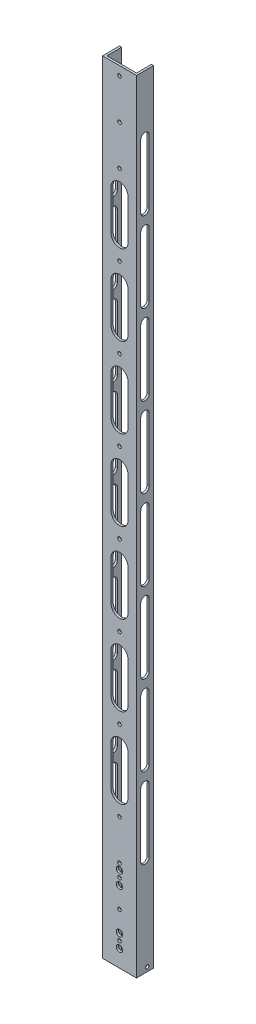
from build123d import *

# Parameters (mm, degrees)
BOSS_EXTRUDE1_DEPTH = 1168.4
IGUS_HOLES_REACH    = 1171.78
SKETCH2_R           = 2.667
CUT_EXTRUDE2_REACH  = 1171.715
SKETCH3_R           = 4.7625
SKETCH3_R_2         = 2.667
SKETCH4_R           = 2.667
CUT_EXTRUDE3_DEPTH  = 1170.77962027
BACK_CUTS_REACH     = 1171.78
CUT_EXTRUDE5_DEPTH  = 1170.77962027


with BuildPart() as part:
    # Sketch1 → Boss-Extrude1 (new body)
    with BuildSketch(Plane(origin=(0, 0, 0), x_dir=(1, 0, 0), z_dir=(0, 1, 0))):
        Polygon((3.175, 3.175), (3.175, 25.4), (0, 25.4), (0, 0), (50.8, 0), (50.8, 25.4), (47.625, 25.4), (47.625, 3.175), align=None)
    extrude(amount=BOSS_EXTRUDE1_DEPTH)

    # Sketch2 → Igus_Holes (cut, up to next)
    with BuildSketch(Plane.XY, mode=Mode.PRIVATE) as igus_holes_sk1:
        with Locations((25.4, 76.2)):
            Circle(SKETCH2_R)
    igus_holes_tool1 = extrude(igus_holes_sk1.sketch, amount=-IGUS_HOLES_REACH, mode=Mode.PRIVATE) & part.part
    # Sketch2 → Igus_Holes (cut, up to next)
    with BuildSketch(Plane.XY, mode=Mode.PRIVATE) as igus_holes_sk2:
        with Locations((25.4, 136.144)):
            Circle(SKETCH2_R)
    igus_holes_tool2 = extrude(igus_holes_sk2.sketch, amount=-IGUS_HOLES_REACH, mode=Mode.PRIVATE) & part.part
    # Sketch2 → Igus_Holes (cut, up to next)
    with BuildSketch(Plane.XY, mode=Mode.PRIVATE) as igus_holes_sk3:
        with Locations((25.4, 196.088)):
            Circle(SKETCH2_R)
    igus_holes_tool3 = extrude(igus_holes_sk3.sketch, amount=-IGUS_HOLES_REACH, mode=Mode.PRIVATE) & part.part
    # Sketch2 → Igus_Holes (cut, up to next)
    with BuildSketch(Plane.XY, mode=Mode.PRIVATE) as igus_holes_sk4:
        with Locations((25.4, 256.032)):
            Circle(SKETCH2_R)
    igus_holes_tool4 = extrude(igus_holes_sk4.sketch, amount=-IGUS_HOLES_REACH, mode=Mode.PRIVATE) & part.part
    # Sketch2 → Igus_Holes (cut, up to next)
    with BuildSketch(Plane.XY, mode=Mode.PRIVATE) as igus_holes_sk5:
        with Locations((25.4, 315.976)):
            Circle(SKETCH2_R)
    igus_holes_tool5 = extrude(igus_holes_sk5.sketch, amount=-IGUS_HOLES_REACH, mode=Mode.PRIVATE) & part.part
    # Sketch2 → Igus_Holes (cut, up to next)
    with BuildSketch(Plane.XY, mode=Mode.PRIVATE) as igus_holes_sk6:
        with Locations((25.4, 375.92)):
            Circle(SKETCH2_R)
    igus_holes_tool6 = extrude(igus_holes_sk6.sketch, amount=-IGUS_HOLES_REACH, mode=Mode.PRIVATE) & part.part
    # Sketch2 → Igus_Holes (cut, up to next)
    with BuildSketch(Plane.XY, mode=Mode.PRIVATE) as igus_holes_sk7:
        with Locations((25.4, 435.864)):
            Circle(SKETCH2_R)
    igus_holes_tool7 = extrude(igus_holes_sk7.sketch, amount=-IGUS_HOLES_REACH, mode=Mode.PRIVATE) & part.part
    # Sketch2 → Igus_Holes (cut, up to next)
    with BuildSketch(Plane.XY, mode=Mode.PRIVATE) as igus_holes_sk8:
        with Locations((25.4, 495.808)):
            Circle(SKETCH2_R)
    igus_holes_tool8 = extrude(igus_holes_sk8.sketch, amount=-IGUS_HOLES_REACH, mode=Mode.PRIVATE) & part.part
    # Sketch2 → Igus_Holes (cut, up to next)
    with BuildSketch(Plane.XY, mode=Mode.PRIVATE) as igus_holes_sk9:
        with Locations((25.4, 555.752)):
            Circle(SKETCH2_R)
    igus_holes_tool9 = extrude(igus_holes_sk9.sketch, amount=-IGUS_HOLES_REACH, mode=Mode.PRIVATE) & part.part
    # Sketch2 → Igus_Holes (cut, up to next)
    with BuildSketch(Plane.XY, mode=Mode.PRIVATE) as igus_holes_sk10:
        with Locations((25.4, 615.696)):
            Circle(SKETCH2_R)
    igus_holes_tool10 = extrude(igus_holes_sk10.sketch, amount=-IGUS_HOLES_REACH, mode=Mode.PRIVATE) & part.part
    # Sketch2 → Igus_Holes (cut, up to next)
    with BuildSketch(Plane.XY, mode=Mode.PRIVATE) as igus_holes_sk11:
        with Locations((25.4, 675.64)):
            Circle(SKETCH2_R)
    igus_holes_tool11 = extrude(igus_holes_sk11.sketch, amount=-IGUS_HOLES_REACH, mode=Mode.PRIVATE) & part.part
    # Sketch2 → Igus_Holes (cut, up to next)
    with BuildSketch(Plane.XY, mode=Mode.PRIVATE) as igus_holes_sk12:
        with Locations((25.4, 735.584)):
            Circle(SKETCH2_R)
    igus_holes_tool12 = extrude(igus_holes_sk12.sketch, amount=-IGUS_HOLES_REACH, mode=Mode.PRIVATE) & part.part
    # Sketch2 → Igus_Holes (cut, up to next)
    with BuildSketch(Plane.XY, mode=Mode.PRIVATE) as igus_holes_sk13:
        with Locations((25.4, 795.528)):
            Circle(SKETCH2_R)
    igus_holes_tool13 = extrude(igus_holes_sk13.sketch, amount=-IGUS_HOLES_REACH, mode=Mode.PRIVATE) & part.part
    # Sketch2 → Igus_Holes (cut, up to next)
    with BuildSketch(Plane.XY, mode=Mode.PRIVATE) as igus_holes_sk14:
        with Locations((25.4, 855.472)):
            Circle(SKETCH2_R)
    igus_holes_tool14 = extrude(igus_holes_sk14.sketch, amount=-IGUS_HOLES_REACH, mode=Mode.PRIVATE) & part.part
    # Sketch2 → Igus_Holes (cut, up to next)
    with BuildSketch(Plane.XY, mode=Mode.PRIVATE) as igus_holes_sk15:
        with Locations((25.4, 915.416)):
            Circle(SKETCH2_R)
    igus_holes_tool15 = extrude(igus_holes_sk15.sketch, amount=-IGUS_HOLES_REACH, mode=Mode.PRIVATE) & part.part
    # Sketch2 → Igus_Holes (cut, up to next)
    with BuildSketch(Plane.XY, mode=Mode.PRIVATE) as igus_holes_sk16:
        with Locations((25.4, 975.36)):
            Circle(SKETCH2_R)
    igus_holes_tool16 = extrude(igus_holes_sk16.sketch, amount=-IGUS_HOLES_REACH, mode=Mode.PRIVATE) & part.part
    # Sketch2 → Igus_Holes (cut, up to next)
    with BuildSketch(Plane.XY, mode=Mode.PRIVATE) as igus_holes_sk17:
        with Locations((25.4, 1035.304)):
            Circle(SKETCH2_R)
    igus_holes_tool17 = extrude(igus_holes_sk17.sketch, amount=-IGUS_HOLES_REACH, mode=Mode.PRIVATE) & part.part
    # Sketch2 → Igus_Holes (cut, up to next)
    with BuildSketch(Plane.XY, mode=Mode.PRIVATE) as igus_holes_sk18:
        with Locations((25.4, 1095.248)):
            Circle(SKETCH2_R)
    igus_holes_tool18 = extrude(igus_holes_sk18.sketch, amount=-IGUS_HOLES_REACH, mode=Mode.PRIVATE) & part.part
    # Sketch2 → Igus_Holes (cut, up to next)
    with BuildSketch(Plane.XY, mode=Mode.PRIVATE) as igus_holes_sk19:
        with Locations((25.4, 1155.192)):
            Circle(SKETCH2_R)
    igus_holes_tool19 = extrude(igus_holes_sk19.sketch, amount=-IGUS_HOLES_REACH, mode=Mode.PRIVATE) & part.part
    add(igus_holes_tool1.solids().sort_by_distance((25.4, 76.2, 0))[0], mode=Mode.SUBTRACT)
    add(igus_holes_tool2.solids().sort_by_distance((25.4, 136.144, 0))[0], mode=Mode.SUBTRACT)
    add(igus_holes_tool3.solids().sort_by_distance((25.4, 196.088, 0))[0], mode=Mode.SUBTRACT)
    add(igus_holes_tool4.solids().sort_by_distance((25.4, 256.032, 0))[0], mode=Mode.SUBTRACT)
    add(igus_holes_tool5.solids().sort_by_distance((25.4, 315.976, 0))[0], mode=Mode.SUBTRACT)
    add(igus_holes_tool6.solids().sort_by_distance((25.4, 375.92, 0))[0], mode=Mode.SUBTRACT)
    add(igus_holes_tool7.solids().sort_by_distance((25.4, 435.864, 0))[0], mode=Mode.SUBTRACT)
    add(igus_holes_tool8.solids().sort_by_distance((25.4, 495.808, 0))[0], mode=Mode.SUBTRACT)
    add(igus_holes_tool9.solids().sort_by_distance((25.4, 555.752, 0))[0], mode=Mode.SUBTRACT)
    add(igus_holes_tool10.solids().sort_by_distance((25.4, 615.696, 0))[0], mode=Mode.SUBTRACT)
    add(igus_holes_tool11.solids().sort_by_distance((25.4, 675.64, 0))[0], mode=Mode.SUBTRACT)
    add(igus_holes_tool12.solids().sort_by_distance((25.4, 735.584, 0))[0], mode=Mode.SUBTRACT)
    add(igus_holes_tool13.solids().sort_by_distance((25.4, 795.528, 0))[0], mode=Mode.SUBTRACT)
    add(igus_holes_tool14.solids().sort_by_distance((25.4, 855.472, 0))[0], mode=Mode.SUBTRACT)
    add(igus_holes_tool15.solids().sort_by_distance((25.4, 915.416, 0))[0], mode=Mode.SUBTRACT)
    add(igus_holes_tool16.solids().sort_by_distance((25.4, 975.36, 0))[0], mode=Mode.SUBTRACT)
    add(igus_holes_tool17.solids().sort_by_distance((25.4, 1035.304, 0))[0], mode=Mode.SUBTRACT)
    add(igus_holes_tool18.solids().sort_by_distance((25.4, 1095.248, 0))[0], mode=Mode.SUBTRACT)
    add(igus_holes_tool19.solids().sort_by_distance((25.4, 1155.192, 0))[0], mode=Mode.SUBTRACT)

    # Sketch3 → Cut-Extrude2 (cut, up to next)
    with BuildSketch(Plane(origin=(0, 0, -3.175), x_dir=(-1, 0, 0), z_dir=(0, 0, -1)), mode=Mode.PRIVATE) as cut_extrude2_sk1:
        with Locations((-25.4, 25.4)):
            Circle(SKETCH3_R)
    cut_extrude2_tool1 = extrude(cut_extrude2_sk1.sketch, amount=-CUT_EXTRUDE2_REACH, mode=Mode.PRIVATE) & part.part
    # Sketch3 → Cut-Extrude2 (cut, up to next)
    with BuildSketch(Plane(origin=(0, 0, -3.175), x_dir=(-1, 0, 0), z_dir=(0, 0, -1)), mode=Mode.PRIVATE) as cut_extrude2_sk2:
        with Locations((-25.4, 35.39998)):
            Circle(SKETCH3_R_2)
    cut_extrude2_tool2 = extrude(cut_extrude2_sk2.sketch, amount=-CUT_EXTRUDE2_REACH, mode=Mode.PRIVATE) & part.part
    # Sketch3 → Cut-Extrude2 (cut, up to next)
    with BuildSketch(Plane(origin=(0, 0, -3.175), x_dir=(-1, 0, 0), z_dir=(0, 0, -1)), mode=Mode.PRIVATE) as cut_extrude2_sk3:
        with Locations((-25.4, 117.00002)):
            Circle(SKETCH3_R_2)
    cut_extrude2_tool3 = extrude(cut_extrude2_sk3.sketch, amount=-CUT_EXTRUDE2_REACH, mode=Mode.PRIVATE) & part.part
    # Sketch3 → Cut-Extrude2 (cut, up to next)
    with BuildSketch(Plane(origin=(0, 0, -3.175), x_dir=(-1, 0, 0), z_dir=(0, 0, -1)), mode=Mode.PRIVATE) as cut_extrude2_sk4:
        with Locations((-25.4, 45.39996)):
            Circle(SKETCH3_R)
    cut_extrude2_tool4 = extrude(cut_extrude2_sk4.sketch, amount=-CUT_EXTRUDE2_REACH, mode=Mode.PRIVATE) & part.part
    # Sketch3 → Cut-Extrude2 (cut, up to next)
    with BuildSketch(Plane(origin=(0, 0, -3.175), x_dir=(-1, 0, 0), z_dir=(0, 0, -1)), mode=Mode.PRIVATE) as cut_extrude2_sk5:
        with Locations((-25.4, 107.00004)):
            Circle(SKETCH3_R)
    cut_extrude2_tool5 = extrude(cut_extrude2_sk5.sketch, amount=-CUT_EXTRUDE2_REACH, mode=Mode.PRIVATE) & part.part
    # Sketch3 → Cut-Extrude2 (cut, up to next)
    with BuildSketch(Plane(origin=(0, 0, -3.175), x_dir=(-1, 0, 0), z_dir=(0, 0, -1)), mode=Mode.PRIVATE) as cut_extrude2_sk6:
        with Locations((-25.4, 127)):
            Circle(SKETCH3_R)
    cut_extrude2_tool6 = extrude(cut_extrude2_sk6.sketch, amount=-CUT_EXTRUDE2_REACH, mode=Mode.PRIVATE) & part.part
    add(cut_extrude2_tool1.solids().sort_by_distance((25.4, 25.4, -3.175))[0], mode=Mode.SUBTRACT)
    add(cut_extrude2_tool2.solids().sort_by_distance((25.4, 35.39998, -3.175))[0], mode=Mode.SUBTRACT)
    add(cut_extrude2_tool3.solids().sort_by_distance((25.4, 117.00002, -3.175))[0], mode=Mode.SUBTRACT)
    add(cut_extrude2_tool4.solids().sort_by_distance((25.4, 45.39996, -3.175))[0], mode=Mode.SUBTRACT)
    add(cut_extrude2_tool5.solids().sort_by_distance((25.4, 107.00004, -3.175))[0], mode=Mode.SUBTRACT)
    add(cut_extrude2_tool6.solids().sort_by_distance((25.4, 127, -3.175))[0], mode=Mode.SUBTRACT)

    # Sketch4 → Cut-Extrude3 (cut, through all)
    with BuildSketch(Plane.ZY):
        with Locations((-15.875, 6.35)):
            Circle(SKETCH4_R)
    extrude(amount=-CUT_EXTRUDE3_DEPTH, mode=Mode.SUBTRACT)

    # Sketch5 → Back_Cuts (cut, up to next)
    with BuildSketch(Plane.XY, mode=Mode.PRIVATE) as back_cuts_sk1:
        with BuildLine():
            Line((38.1, 1005.36), (38.1, 945.36))
            ThreePointArc((38.1, 945.36), (25.4, 932.66), (12.7, 945.36))
            Line((12.7, 945.36), (12.7, 1005.36))
            ThreePointArc((12.7, 1005.36), (25.4, 1018.06), (38.1, 1005.36))
        make_face()
    back_cuts_tool1 = extrude(back_cuts_sk1.sketch, amount=-BACK_CUTS_REACH, mode=Mode.PRIVATE) & part.part
    # Sketch5 → Back_Cuts (cut, up to next)
    with BuildSketch(Plane.XY, mode=Mode.PRIVATE) as back_cuts_sk2:
        with BuildLine():
            Line((38.1, 885.472), (38.1, 825.472))
            ThreePointArc((38.1, 825.472), (25.4, 812.772), (12.7, 825.472))
            Line((12.7, 825.472), (12.7, 885.472))
            ThreePointArc((12.7, 885.472), (25.4, 898.172), (38.1, 885.472))
        make_face()
    back_cuts_tool2 = extrude(back_cuts_sk2.sketch, amount=-BACK_CUTS_REACH, mode=Mode.PRIVATE) & part.part
    # Sketch5 → Back_Cuts (cut, up to next)
    with BuildSketch(Plane.XY, mode=Mode.PRIVATE) as back_cuts_sk3:
        with BuildLine():
            Line((38.1, 765.584), (38.1, 705.584))
            ThreePointArc((38.1, 705.584), (25.4, 692.884), (12.7, 705.584))
            Line((12.7, 705.584), (12.7, 765.584))
            ThreePointArc((12.7, 765.584), (25.4, 778.284), (38.1, 765.584))
        make_face()
    back_cuts_tool3 = extrude(back_cuts_sk3.sketch, amount=-BACK_CUTS_REACH, mode=Mode.PRIVATE) & part.part
    # Sketch5 → Back_Cuts (cut, up to next)
    with BuildSketch(Plane.XY, mode=Mode.PRIVATE) as back_cuts_sk4:
        with BuildLine():
            Line((38.1, 645.696), (38.1, 585.696))
            ThreePointArc((38.1, 585.696), (25.4, 572.996), (12.7, 585.696))
            Line((12.7, 585.696), (12.7, 645.696))
            ThreePointArc((12.7, 645.696), (25.4, 658.396), (38.1, 645.696))
        make_face()
    back_cuts_tool4 = extrude(back_cuts_sk4.sketch, amount=-BACK_CUTS_REACH, mode=Mode.PRIVATE) & part.part
    # Sketch5 → Back_Cuts (cut, up to next)
    with BuildSketch(Plane.XY, mode=Mode.PRIVATE) as back_cuts_sk5:
        with BuildLine():
            Line((38.1, 525.808), (38.1, 465.808))
            ThreePointArc((38.1, 465.808), (25.4, 453.108), (12.7, 465.808))
            Line((12.7, 465.808), (12.7, 525.808))
            ThreePointArc((12.7, 525.808), (25.4, 538.508), (38.1, 525.808))
        make_face()
    back_cuts_tool5 = extrude(back_cuts_sk5.sketch, amount=-BACK_CUTS_REACH, mode=Mode.PRIVATE) & part.part
    # Sketch5 → Back_Cuts (cut, up to next)
    with BuildSketch(Plane.XY, mode=Mode.PRIVATE) as back_cuts_sk6:
        with BuildLine():
            Line((38.1, 405.92), (38.1, 345.92))
            ThreePointArc((38.1, 345.92), (25.4, 333.22), (12.7, 345.92))
            Line((12.7, 345.92), (12.7, 405.92))
            ThreePointArc((12.7, 405.92), (25.4, 418.62), (38.1, 405.92))
        make_face()
    back_cuts_tool6 = extrude(back_cuts_sk6.sketch, amount=-BACK_CUTS_REACH, mode=Mode.PRIVATE) & part.part
    # Sketch5 → Back_Cuts (cut, up to next)
    with BuildSketch(Plane.XY, mode=Mode.PRIVATE) as back_cuts_sk7:
        with BuildLine():
            Line((38.1, 286.032), (38.1, 226.032))
            ThreePointArc((38.1, 226.032), (25.4, 213.332), (12.7, 226.032))
            Line((12.7, 226.032), (12.7, 286.032))
            ThreePointArc((12.7, 286.032), (25.4, 298.732), (38.1, 286.032))
        make_face()
    back_cuts_tool7 = extrude(back_cuts_sk7.sketch, amount=-BACK_CUTS_REACH, mode=Mode.PRIVATE) & part.part
    add(back_cuts_tool1.solids().sort_by_distance((25.4, 975.36, 0))[0], mode=Mode.SUBTRACT)
    add(back_cuts_tool2.solids().sort_by_distance((25.4, 855.472, 0))[0], mode=Mode.SUBTRACT)
    add(back_cuts_tool3.solids().sort_by_distance((25.4, 735.584, 0))[0], mode=Mode.SUBTRACT)
    add(back_cuts_tool4.solids().sort_by_distance((25.4, 615.696, 0))[0], mode=Mode.SUBTRACT)
    add(back_cuts_tool5.solids().sort_by_distance((25.4, 495.808, 0))[0], mode=Mode.SUBTRACT)
    add(back_cuts_tool6.solids().sort_by_distance((25.4, 375.92, 0))[0], mode=Mode.SUBTRACT)
    add(back_cuts_tool7.solids().sort_by_distance((25.4, 256.032, 0))[0], mode=Mode.SUBTRACT)

    # Sketch6 → Cut-Extrude5 (cut, through all)
    with BuildSketch(Plane.ZY):
        with BuildLine():
            Line((-6.35, 1082.05), (-6.35, 987.25))
            ThreePointArc((-6.35, 987.25), (-12.7, 980.9), (-19.05, 987.25))
            Line((-19.05, 987.25), (-19.05, 1082.05))
            ThreePointArc((-19.05, 1082.05), (-12.7, 1088.4), (-6.35, 1082.05))
        make_face()
        with BuildLine():
            Line((-6.35, 962.05), (-6.35, 867.25))
            ThreePointArc((-6.35, 867.25), (-12.7, 860.9), (-19.05, 867.25))
            Line((-19.05, 867.25), (-19.05, 962.05))
            ThreePointArc((-19.05, 962.05), (-12.7, 968.4), (-6.35, 962.05))
        make_face()
        with BuildLine():
            Line((-6.35, 842.05), (-6.35, 747.25))
            ThreePointArc((-6.35, 747.25), (-12.7, 740.9), (-19.05, 747.25))
            Line((-19.05, 747.25), (-19.05, 842.05))
            ThreePointArc((-19.05, 842.05), (-12.7, 848.4), (-6.35, 842.05))
        make_face()
        with BuildLine():
            Line((-6.35, 722.05), (-6.35, 627.25))
            ThreePointArc((-6.35, 627.25), (-12.7, 620.9), (-19.05, 627.25))
            Line((-19.05, 627.25), (-19.05, 722.05))
            ThreePointArc((-19.05, 722.05), (-12.7, 728.4), (-6.35, 722.05))
        make_face()
        with BuildLine():
            Line((-6.35, 602.05), (-6.35, 507.25))
            ThreePointArc((-6.35, 507.25), (-12.7, 500.9), (-19.05, 507.25))
            Line((-19.05, 507.25), (-19.05, 602.05))
            ThreePointArc((-19.05, 602.05), (-12.7, 608.4), (-6.35, 602.05))
        make_face()
        with BuildLine():
            Line((-6.35, 482.05), (-6.35, 387.25))
            ThreePointArc((-6.35, 387.25), (-12.7, 380.9), (-19.05, 387.25))
            Line((-19.05, 387.25), (-19.05, 482.05))
            ThreePointArc((-19.05, 482.05), (-12.7, 488.4), (-6.35, 482.05))
        make_face()
        with BuildLine():
            Line((-6.35, 362.05), (-6.35, 267.25))
            ThreePointArc((-6.35, 267.25), (-12.7, 260.9), (-19.05, 267.25))
            Line((-19.05, 267.25), (-19.05, 362.05))
            ThreePointArc((-19.05, 362.05), (-12.7, 368.4), (-6.35, 362.05))
        make_face()
        with BuildLine():
            Line((-6.35, 242.05), (-6.35, 147.25))
            ThreePointArc((-6.35, 147.25), (-12.7, 140.9), (-19.05, 147.25))
            Line((-19.05, 147.25), (-19.05, 242.05))
            ThreePointArc((-19.05, 242.05), (-12.7, 248.4), (-6.35, 242.05))
        make_face()
    extrude(amount=-CUT_EXTRUDE5_DEPTH, mode=Mode.SUBTRACT)


solid = part.part
